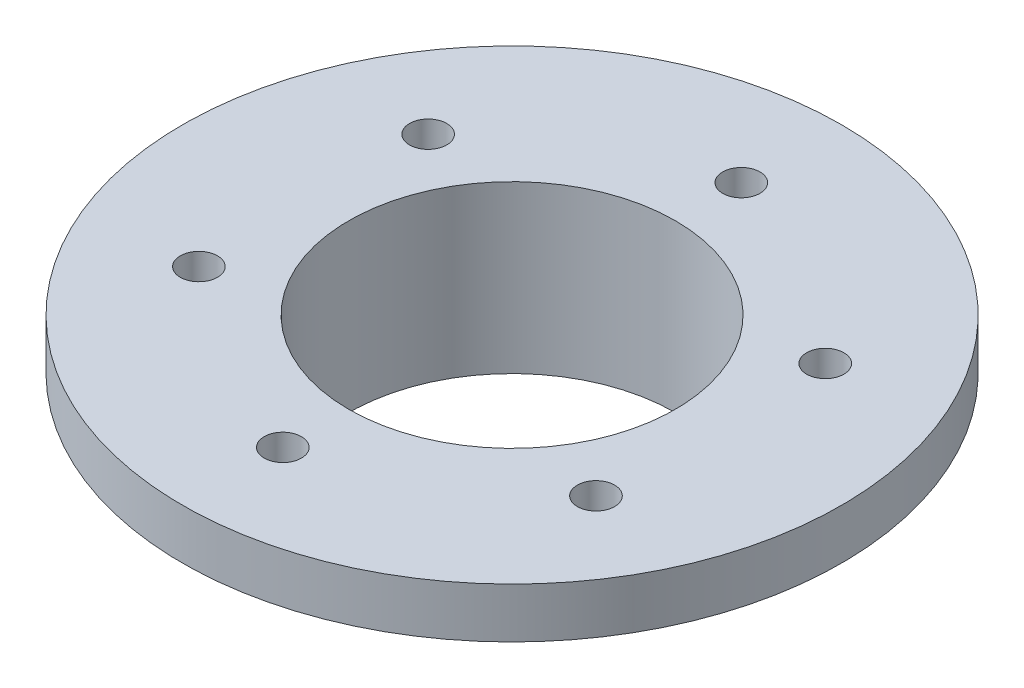
from build123d import *

# Parameters (mm, degrees)
SKETCH2_R          = 3.25
CUT_EXTRUDE1_DEPTH = 87.333655083


with BuildPart() as part:
    # Sketch1 → Revolve1 (revolve)
    with BuildSketch(Plane(origin=(0, 0, 0), x_dir=(0, 0, -1), z_dir=(1, 0, 0))):
        Polygon((28.5, 60.116368241), (57.5, 80.368434357), (57.5, 89.116368241), (28.5, 89.116368241), align=None)
    revolve(axis=Axis((0, 0, 0), (0, 1, 0)))

    # Sketch2 → Cut-Extrude1 (cut, through all)
    with BuildSketch(Plane(origin=(0, 89.116368241, 0), x_dir=(1, 0, 0), z_dir=(0, 1, 0))):
        with Locations((0, -40)):
            Circle(SKETCH2_R)
        with Locations((-34.641016151, -20)):
            Circle(SKETCH2_R)
        with Locations((-34.641016151, 20)):
            Circle(SKETCH2_R)
        with Locations((0, 40)):
            Circle(SKETCH2_R)
        with Locations((34.641016151, 20)):
            Circle(SKETCH2_R)
        with Locations((34.641016151, -20)):
            Circle(SKETCH2_R)
    extrude(amount=-CUT_EXTRUDE1_DEPTH, mode=Mode.SUBTRACT)


solid = part.part
